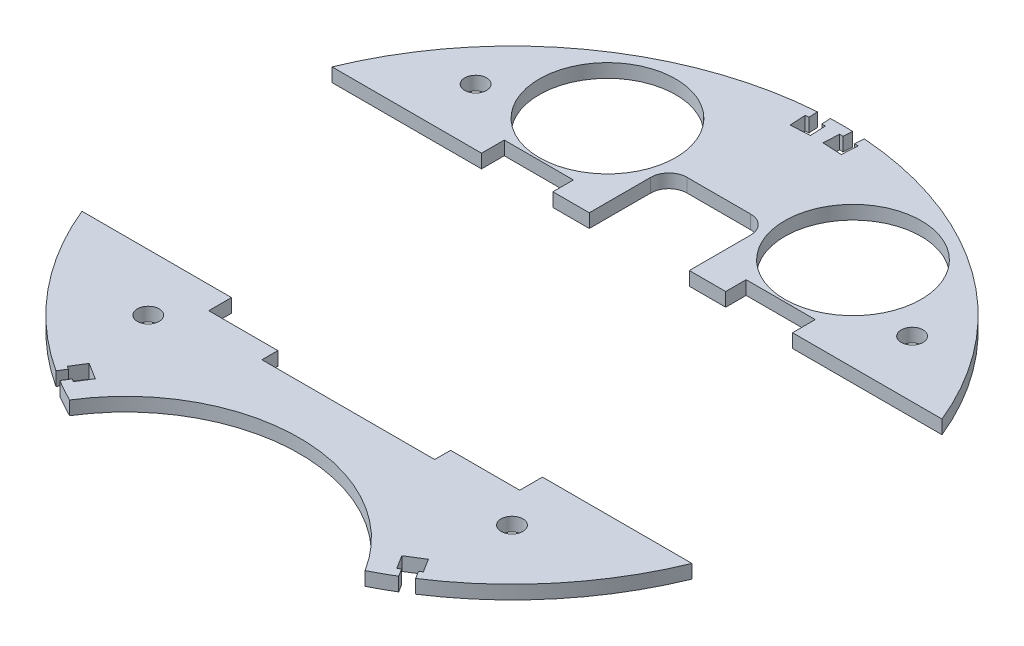
from build123d import *

# Parameters (mm, degrees)
BOSS_EXTRUDE1_DEPTH  = 3
SOLENOID_PLACEMENT_W = 38
SOLENOID_PLACEMENT_H = 64
CUT_EXTRUDE1_DEPTH   = 103.574363269
SKETCH3_R            = 12
CUT_EXTRUDE3_DEPTH   = 103.574363269
SKETCH4_R            = 2.4
CUT_EXTRUDE4_DEPTH   = 103.574363269
CUT_EXTRUDE2_DEPTH   = 103.574363269
CUT_EXTRUDE5_DEPTH   = 99.819470342
SKETCH6_R            = 15
CUT_EXTRUDE10_DEPTH  = 99.819470342
CUT_EXTRUDE11_DEPTH  = 99.819470342


with BuildPart() as part:
    # Sketch1 → Boss-Extrude1 (new body)
    with BuildSketch(Plane(origin=(0, 0, 0), x_dir=(1, 0, 0), z_dir=(0, 1, 0))):
        with BuildLine():
            ThreePointArc((32.48910875, -64.812867647), (0, 72.5), (-32.48910875, -64.812867647))
            ThreePointArc((-32.48910875, -64.812867647), (0, -46.75), (32.48910875, -64.812867647))
        make_face()
    extrude(amount=BOSS_EXTRUDE1_DEPTH)

    # solenoid placement → Cut-Extrude1 (cut, through all)
    with BuildSketch(Plane(origin=(0, 3, 0), x_dir=(1, 0, 0), z_dir=(0, 1, 0))):
        with Locations((0, -4)):
            Rectangle(SOLENOID_PLACEMENT_W, SOLENOID_PLACEMENT_H)
    extrude(amount=-CUT_EXTRUDE1_DEPTH, mode=Mode.SUBTRACT)

    # Sketch3 → Cut-Extrude3 (cut, through all)
    with BuildSketch(Plane(origin=(0, 3, 0), x_dir=(1, 0, 0), z_dir=(0, 1, 0))):
        with Locations((27, 48)):
            Circle(SKETCH3_R)
        with Locations((-27, 48)):
            Circle(SKETCH3_R)
    extrude(amount=-CUT_EXTRUDE3_DEPTH, mode=Mode.SUBTRACT)

    # Sketch4 → Cut-Extrude4 (cut, through all)
    with BuildSketch(Plane(origin=(0, 3, 0), x_dir=(1, 0, 0), z_dir=(0, 1, 0))):
        with Locations((40, -40)):
            Circle(SKETCH4_R)
        with Locations((-40, -40)):
            Circle(SKETCH4_R)
        with Locations((48, 40)):
            Circle(SKETCH4_R)
        with Locations((-48, 40)):
            Circle(SKETCH4_R)
    extrude(amount=-CUT_EXTRUDE4_DEPTH, mode=Mode.SUBTRACT)

    # Sketch2 → Cut-Extrude2 (cut, through all)
    with BuildSketch(Plane(origin=(0, 3, 0), x_dir=(1, 0, 0), z_dir=(0, 1, 0))):
        with BuildLine():
            Line((34.2, -27.500685802), (34.2, -32.500685802))
            Line((34.2, -32.500685802), (22.2, -32.500685802))
            Line((22.2, -32.500685802), (19, -32.500685802))
            Line((19, -32.500685802), (19, 32.499314198))
            Line((19, 32.499314198), (22.2, 32.499314198))
            Line((22.2, 32.499314198), (34.2, 32.499314198))
            Line((34.2, 32.499314198), (34.2, 27.499314198))
            Line((34.2, 27.499314198), (67.082320463, 27.499314198))
            ThreePointArc((67.082320463, 27.499314198), (72.499999996, -0.000741192), (67.081758179, -27.500685802))
            Line((67.081758179, -27.500685802), (34.2, -27.500685802))
        make_face()
        with BuildLine():
            Line((-34.2, -32.500685802), (-22.2, -32.500685802))
            Line((-22.2, -32.500685802), (-19, -32.500685802))
            Line((-19, -32.500685802), (-19, 32.499314198))
            Line((-19, 32.499314198), (-22.2, 32.499314198))
            Line((-22.2, 32.499314198), (-34.2, 32.499314198))
            Line((-34.2, 32.499314198), (-34.2, 27.499314198))
            Line((-34.2, 27.499314198), (-67.082320463, 27.499314198))
            ThreePointArc((-67.082320463, 27.499314198), (-72.499999996, -0.000741192), (-67.081758179, -27.500685802))
            Line((-67.081758179, -27.500685802), (-34.2, -27.500685802))
            Line((-34.2, -27.500685802), (-34.2, -32.500685802))
        make_face()
    extrude(amount=-CUT_EXTRUDE2_DEPTH, mode=Mode.SUBTRACT)


with BuildPart() as cut_extrude2_piece_1:
    # of the separate pieces the step leaves, piece 1, a body of its own (cut_extrude2_pieces)
    add(part.part.solids().sort_by_distance((67.082320463, 0, -27.499314198))[0])

    # Sketch5 → Cut-Extrude5 (cut, through all)
    with BuildSketch(Plane(origin=(0, 3, 0), x_dir=(1, 0, 0), z_dir=(0, 1, 0))):
        with BuildLine():
            Line((-11, 41.5), (-11, 28))
            Line((-11, 28), (11, 28))
            Line((11, 28), (11, 41.5))
            ThreePointArc((11, 41.5), (9.828427125, 44.328427125), (7, 45.5))
            Line((7, 45.5), (-7, 45.5))
            ThreePointArc((-7, 45.5), (-9.828427125, 44.328427125), (-11, 41.5))
        make_face()
    extrude(amount=-CUT_EXTRUDE5_DEPTH, mode=Mode.SUBTRACT)

    # Sketch6 → Cut-Extrude10 (cut, through all)
    with BuildSketch(Plane(origin=(0, 3, 0), x_dir=(-1, 0, 0), z_dir=(0, 1, 0))):
        with Locations((-27, -48)):
            Circle(SKETCH6_R)
        with Locations((27, -48)):
            Circle(SKETCH6_R)
    extrude(amount=-CUT_EXTRUDE10_DEPTH, mode=Mode.SUBTRACT)


with BuildPart() as cut_extrude2_piece_2:
    # of the separate pieces the step leaves, piece 2, a body of its own (cut_extrude2_pieces)
    add(part.part.solids().sort_by_distance((32.48910875, 0, 64.812867647))[0])


with BuildPart() as cut_extrude11_tool:
    # Sketch7 → Cut-Extrude11 (new, through all)
    with BuildSketch(Plane(origin=(0, 3, 0), x_dir=(1, 0, 0), z_dir=(0, 1, 0))):
        Polygon((-5.037834787, 70.332728659), (-5.811772676, 70.292168293), (-5.62859683, 66.796964922), (-1.384421307, 67.019392736), (-1.567597154, 70.514596107), (-2.341535043, 70.474035741), (-2.446206956, 72.471294811), (-5.1425067, 72.329987729), align=None)
        Polygon((5.811772676, 70.292168293), (5.037834787, 70.332728659), (5.1425067, 72.329987729), (2.446206956, 72.471294811), (2.341535043, 70.474035741), (1.567597154, 70.514596107), (1.384421307, 67.019392736), (5.62859683, 66.796964922), align=None)
        Polygon((38.504173058, -59.071999772), (39.161410333, -58.661312343), (37.306692908, -55.693144006), (33.702488499, -57.945300879), (35.557205924, -60.913469216), (36.214443199, -60.502781786), (37.274281727, -62.198877978), (39.564011587, -60.768095965), align=None)
        Polygon((-39.161410333, -58.661312343), (-38.504173058, -59.071999772), (-39.564011587, -60.768095965), (-37.274281727, -62.198877978), (-36.214443199, -60.502781786), (-35.557205924, -60.913469216), (-33.702488499, -57.945300879), (-37.306692908, -55.693144006), align=None)
    extrude(amount=-CUT_EXTRUDE11_DEPTH)


with BuildPart() as cut_extrude2_piece_1_1:
    add(cut_extrude2_piece_1.part)

    # Cut-Extrude11: cut by cut_extrude11_tool
    add(cut_extrude11_tool.part, mode=Mode.SUBTRACT)


with BuildPart() as cut_extrude2_piece_2_1:
    add(cut_extrude2_piece_2.part)

    # Cut-Extrude11: cut by cut_extrude11_tool
    add(cut_extrude11_tool.part, mode=Mode.SUBTRACT)


solid = Compound([cut_extrude2_piece_1_1.part, cut_extrude2_piece_2_1.part])
